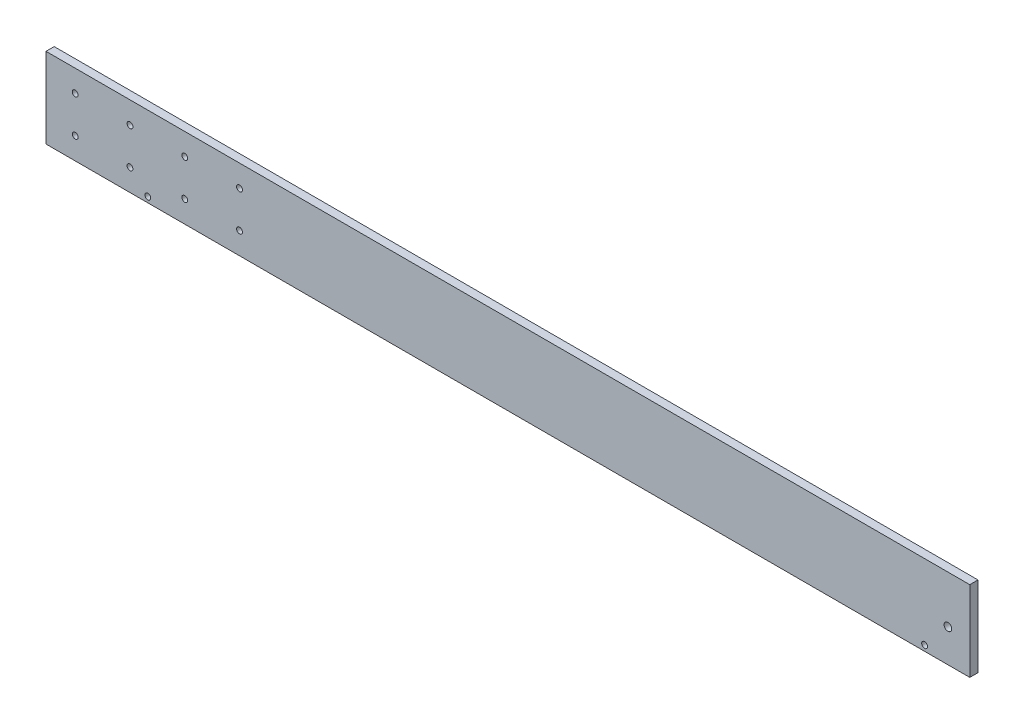
from build123d import *

# Parameters (mm, degrees)
SKETCH1_W           = 506
SKETCH1_H           = 44
SKETCH1_R           = 2.1
SKETCH1_R_2         = 1.6
BOSS_EXTRUDE1_DEPTH = 4.5


with BuildPart() as part:
    # Sketch1 → Boss-Extrude1 (new body)
    with BuildSketch(Plane.XY):
        Rectangle(SKETCH1_W, SKETCH1_H)
        with Locations((241, -4)):
            Circle(SKETCH1_R, mode=Mode.SUBTRACT)
        with Locations((-237, 10)):
            Circle(SKETCH1_R_2, mode=Mode.SUBTRACT)
        with Locations((-207, 10)):
            Circle(SKETCH1_R_2, mode=Mode.SUBTRACT)
        with Locations((-177, 10)):
            Circle(SKETCH1_R_2, mode=Mode.SUBTRACT)
        with Locations((-147, 10)):
            Circle(SKETCH1_R_2, mode=Mode.SUBTRACT)
        with Locations((-207, -10)):
            Circle(SKETCH1_R_2, mode=Mode.SUBTRACT)
        with Locations((-177, -10)):
            Circle(SKETCH1_R_2, mode=Mode.SUBTRACT)
        with Locations((-147, -10)):
            Circle(SKETCH1_R_2, mode=Mode.SUBTRACT)
        with Locations((-237, -10)):
            Circle(SKETCH1_R_2, mode=Mode.SUBTRACT)
        with Locations((228.25, -19)):
            Circle(SKETCH1_R_2, mode=Mode.SUBTRACT)
        with Locations((-197.25, -19)):
            Circle(SKETCH1_R_2, mode=Mode.SUBTRACT)
    extrude(amount=BOSS_EXTRUDE1_DEPTH)


solid = part.part
